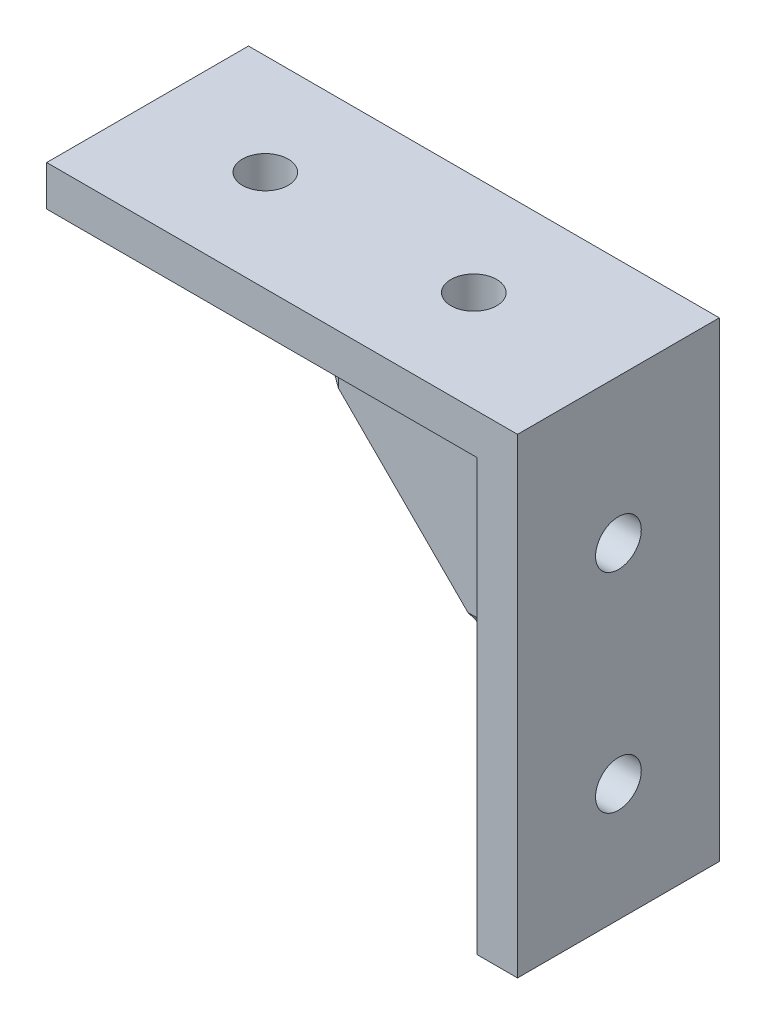
from build123d import *

# Parameters (mm, degrees)
SKETCH1_W           = 35
SKETCH1_H           = 31
BOSS_EXTRUDE1_DEPTH = 15
CUT_EXTRUDE1_DEPTH  = 4
SKETCH3_W           = 35
SKETCH3_H           = 15
BOSS_EXTRUDE2_DEPTH = 4
SKETCH4_W           = 11
SKETCH4_H           = 31
CUT_EXTRUDE2_DEPTH  = 31
SKETCH5_R           = 1.7
CUT_EXTRUDE3_DEPTH  = 48.021271782
SKETCH6_R           = 1.7
CUT_EXTRUDE4_DEPTH  = 54.018864567
SKETCH7_R           = 4
CUT_EXTRUDE5_DEPTH  = 54.018864567
SKETCH8_R           = 4
CUT_EXTRUDE6_DEPTH  = 54.018864567
SKETCH9_R           = 4
CUT_EXTRUDE7_DEPTH  = 48.021271782
CHAMFER1_SIZE       = 1
CHAMFER2_SIZE       = 1


with BuildPart() as part:
    # Sketch1 → Boss-Extrude1 (new body)
    with BuildSketch(Plane(origin=(0, 0, 10), x_dir=(-1, 0, 0), z_dir=(0, 0, -1))):
        with Locations((-7.5, -19.5)):
            Rectangle(SKETCH1_W, SKETCH1_H)
    extrude(amount=-BOSS_EXTRUDE1_DEPTH)

    # Sketch2 → Cut-Extrude1 (cut)
    with BuildSketch(Plane(origin=(0, 0, 10), x_dir=(-1, 0, 0), z_dir=(0, 0, -1))):
        Polygon((10, -4), (-21, -35), (10, -35), align=None)
    extrude(amount=-CUT_EXTRUDE1_DEPTH, mode=Mode.SUBTRACT)

    # Sketch3 → Boss-Extrude2 (add)
    with BuildSketch(Plane(origin=(0, -4, 0), x_dir=(-1, 0, 0), z_dir=(0, 1, 0))):
        with Locations((-7.5, 17.5)):
            Rectangle(SKETCH3_W, SKETCH3_H)
    extrude(amount=BOSS_EXTRUDE2_DEPTH)

    # Sketch4 → Cut-Extrude2 (cut)
    with BuildSketch(Plane.ZY.offset(10)):
        with Locations((19.5, -19.5)):
            Rectangle(SKETCH4_W, SKETCH4_H)
    extrude(amount=-CUT_EXTRUDE2_DEPTH, mode=Mode.SUBTRACT)

    # Sketch5 → Cut-Extrude3 (cut, through all)
    with BuildSketch(Plane.XZ.offset(4)):
        with Locations((-1.25, 17.5)):
            Circle(SKETCH5_R)
        with Locations((14.25, 17.5)):
            Circle(SKETCH5_R)
    extrude(amount=-CUT_EXTRUDE3_DEPTH, mode=Mode.SUBTRACT)

    # Sketch6 → Cut-Extrude4 (cut, through all)
    with BuildSketch(Plane.ZY.offset(-21)):
        with Locations((17.5, -10.75)):
            Circle(SKETCH6_R)
        with Locations((17.5, -26.25)):
            Circle(SKETCH6_R)
    extrude(amount=-CUT_EXTRUDE4_DEPTH, mode=Mode.SUBTRACT)

    # Sketch7 → Cut-Extrude5 (cut, through all)
    with BuildSketch(Plane.ZY.offset(-21)):
        with Locations((17.5, -10.75)):
            Circle(SKETCH7_R)
    extrude(amount=CUT_EXTRUDE5_DEPTH, mode=Mode.SUBTRACT)

    # Sketch8 → Cut-Extrude6 (cut, through all)
    with BuildSketch(Plane.ZY.offset(-21)):
        with Locations((17.5, -26.25)):
            Circle(SKETCH8_R)
    extrude(amount=CUT_EXTRUDE6_DEPTH, mode=Mode.SUBTRACT)

    # Sketch9 → Cut-Extrude7 (cut, through all)
    with BuildSketch(Plane.XZ.offset(4)):
        with Locations((-1.25, 17.5)):
            Circle(SKETCH9_R)
        with Locations((14.25, 17.5)):
            Circle(SKETCH9_R)
    extrude(amount=CUT_EXTRUDE7_DEPTH, mode=Mode.SUBTRACT)

    # Chamfer1
    chamfer1_edges = [part.edges().sort_by_distance(p)[0] for p in [
        (5.5, -4, 25),
    ]]
    chamfer(chamfer1_edges, length=CHAMFER1_SIZE)

    # Chamfer2
    chamfer2_edges = [part.edges().sort_by_distance(p)[0] for p in [
        (21, -19, 25),
    ]]
    chamfer(chamfer2_edges, length=CHAMFER2_SIZE)


solid = part.part
